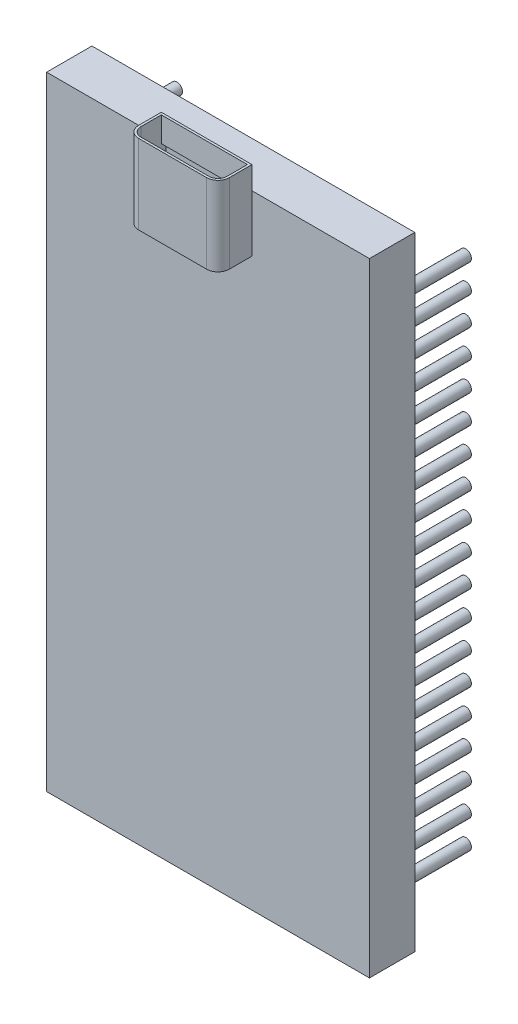
from build123d import *

# Parameters (mm, degrees)
SKETCH1_W           = 55
SKETCH1_H           = 28.5
BOSS_EXTRUDE1_DEPTH = 2
SKETCH2_W           = 8
SKETCH2_H           = 7
BOSS_EXTRUDE2_DEPTH = 3
FILLET2_R           = 1
SHELL2_START        = -27.3
SHELL2_OUTLINE_W    = 28.1
SHELL2_OUTLINE_H    = 3.6
SHELL2_DEPTH        = 54.6
SHELL2_START_2      = 22.7
SHELL2_2_DEPTH      = 6.8
SHELL2_3_OUTLINE_W  = 7.6
SHELL2_3_OUTLINE_H  = 0.4
SHELL2_3_DEPTH      = 4.6
SKETCH3_R           = 0.5
BOSS_EXTRUDE3_DEPTH = 6


# Read off the part's stored shape, not the designer's step: Shell2
with BuildPart() as part:
    # Sketch1 → Boss-Extrude1 (new, symmetric)
    with BuildSketch(Plane(origin=(0, 0, 0), x_dir=(0, 1, 0), z_dir=(0, 0, 1))):
        Rectangle(SKETCH1_W, SKETCH1_H)
    extrude(amount=BOSS_EXTRUDE1_DEPTH, both=True)

    # Sketch2 → Boss-Extrude2 (add)
    with BuildSketch(Plane.XY.offset(2)):
        with Locations((-0.123519145, 26)):
            Rectangle(SKETCH2_W, SKETCH2_H)
    extrude(amount=BOSS_EXTRUDE2_DEPTH)

    # Fillet2
    fillet2_edges = [part.edges().sort_by_distance(p)[0] for p in [
        (3.876480855, 26, 5),
        (-4.123519145, 26, 5),
    ]]
    fillet(fillet2_edges, radius=FILLET2_R)

    # Shell2 outline → Shell2 (cut)
    with BuildSketch(Plane(origin=(0, 0, 0), x_dir=(1, 0, 0), z_dir=(0, 1, 0)).offset(SHELL2_START)):
        Rectangle(SHELL2_OUTLINE_W, SHELL2_OUTLINE_H)
    extrude(amount=SHELL2_DEPTH, mode=Mode.SUBTRACT)

    # Shell2 2 outline → Shell2 2 (cut)
    with BuildSketch(Plane(origin=(0, 0, 0), x_dir=(1, 0, 0), z_dir=(0, 1, 0)).offset(SHELL2_START_2)):
        with BuildLine():
            Line((3.676480855, -4), (3.676480855, -2.2))
            Line((3.676480855, -2.2), (-3.923519145, -2.2))
            Line((-3.923519145, -2.2), (-3.923519145, -4))
            ThreePointArc((-3.923519145, -4), (-3.68920457, -4.565685425), (-3.123519145, -4.8))
            Line((-3.123519145, -4.8), (2.876480855, -4.8))
            ThreePointArc((2.876480855, -4.8), (3.44216628, -4.565685425), (3.676480855, -4))
        make_face()
    extrude(amount=SHELL2_2_DEPTH, mode=Mode.SUBTRACT)

    # Shell2 3 outline → Shell2 3 (cut)
    with BuildSketch(Plane(origin=(0, 0, 0), x_dir=(1, 0, 0), z_dir=(0, 1, 0)).offset(SHELL2_START_2)):
        with Locations((-0.123519145, -2)):
            Rectangle(SHELL2_3_OUTLINE_W, SHELL2_3_OUTLINE_H)
    extrude(amount=SHELL2_3_DEPTH, mode=Mode.SUBTRACT)

    # Sketch3 → Boss-Extrude3 (add)
    with BuildSketch(Plane(origin=(0, 0, -2), x_dir=(1, 0, 0), z_dir=(0, 0, -1))):
        with Locations(Location((12.75, 23, 0), (0, 0, 180))):
            Circle(SKETCH3_R)
        with Locations(Location((12.75, 20.5, 0), (0, 0, 180))):
            Circle(SKETCH3_R)
        with Locations(Location((12.75, 18, 0), (0, 0, 180))):
            Circle(SKETCH3_R)
        with Locations(Location((12.75, 15.5, 0), (0, 0, 180))):
            Circle(SKETCH3_R)
        with Locations(Location((12.75, 13, 0), (0, 0, 180))):
            Circle(SKETCH3_R)
        with Locations(Location((12.75, 10.5, 0), (0, 0, 180))):
            Circle(SKETCH3_R)
        with Locations(Location((12.75, 8, 0), (0, 0, 180))):
            Circle(SKETCH3_R)
        with Locations(Location((12.75, 5.5, 0), (0, 0, 180))):
            Circle(SKETCH3_R)
        with Locations(Location((12.75, 3, 0), (0, 0, 180))):
            Circle(SKETCH3_R)
        with Locations(Location((12.75, 0.5, 0), (0, 0, 180))):
            Circle(SKETCH3_R)
        with Locations(Location((12.75, -2, 0), (0, 0, 180))):
            Circle(SKETCH3_R)
        with Locations(Location((12.75, -4.5, 0), (0, 0, 180))):
            Circle(SKETCH3_R)
        with Locations(Location((12.75, -7, 0), (0, 0, 180))):
            Circle(SKETCH3_R)
        with Locations(Location((12.75, -9.5, 0), (0, 0, 180))):
            Circle(SKETCH3_R)
        with Locations(Location((12.75, -12, 0), (0, 0, 180))):
            Circle(SKETCH3_R)
        with Locations(Location((12.75, -14.5, 0), (0, 0, 180))):
            Circle(SKETCH3_R)
        with Locations(Location((12.75, -17, 0), (0, 0, 180))):
            Circle(SKETCH3_R)
        with Locations(Location((12.75, -19.5, 0), (0, 0, 180))):
            Circle(SKETCH3_R)
        with Locations(Location((12.75, -22, 0), (0, 0, 180))):
            Circle(SKETCH3_R)
    boss_extrude3 = extrude(amount=BOSS_EXTRUDE3_DEPTH)

    # Mirror1: Boss-Extrude3 across plane
    add(boss_extrude3.mirror(Plane(origin=(0, 0, 0), x_dir=(0, 0, 1), z_dir=(1, 0, 0))))


solid = part.part
